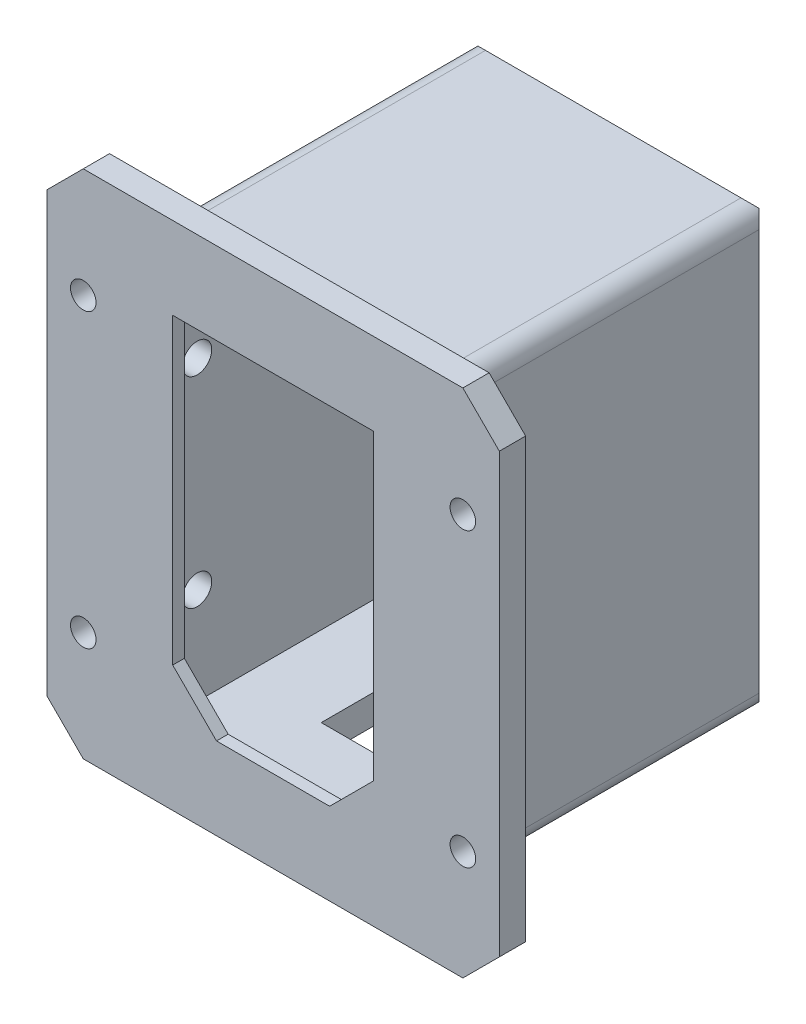
from build123d import *

# Parameters (mm, degrees)
SKETCH1_W           = 62
SKETCH1_H           = 70
SKETCH1_W_2         = 27.5
SKETCH1_H_2         = 47.5
BOSS_EXTRUDE1_DEPTH = 1.6
CHAMFER1_SIZE       = 5
CHAMFER2_SIZE       = 6
SKETCH3_W           = 32
SKETCH3_H           = 52
BOSS_EXTRUDE2_DEPTH = 50
BOSS_EXTRUDE3_DEPTH = 5
SKETCH5_W           = 10
SKETCH5_H           = 45
CUT_EXTRUDE1_DEPTH  = 45
CHAMFER3_SIZE       = 11
CHAMFER4_SIZE       = 10
SKETCH7_R           = 2
CUT_EXTRUDE2_DEPTH  = 83.770767787
MOVE_START          = -2
MOVE_FACE1_DEPTH    = 2
SKETCH8_R           = 1.75
CUT_EXTRUDE3_DEPTH  = 74.413622714


# Read off the part's stored shape, not the designer's step: Move Face1
# Some blends are built 0.0001 mm under size
with BuildPart() as part:
    # Sketch1 → Boss-Extrude1 (new body)
    with BuildSketch(Plane.XY):
        Rectangle(SKETCH1_W, SKETCH1_H)
        Rectangle(SKETCH1_W_2, SKETCH1_H_2, mode=Mode.SUBTRACT)
    extrude(amount=BOSS_EXTRUDE1_DEPTH)

    # Chamfer1
    chamfer1_edges = [part.edges().sort_by_distance(p)[0] for p in [
        (-31, 35, 0.8),
        (31, 35, 0.8),
        (31, -35, 0.8),
        (-31, -35, 0.8),
    ]]
    chamfer(chamfer1_edges, length=CHAMFER1_SIZE)

    # Chamfer2
    chamfer2_edges = [part.edges().sort_by_distance(p)[0] for p in [
        (-13.75, -23.75, 0.8),
        (13.75, -23.75, 0.8),
    ]]
    chamfer(chamfer2_edges, length=CHAMFER2_SIZE)

    # Sketch3 → Boss-Extrude2 (add)
    with BuildSketch(Plane(origin=(0, 0, 0), x_dir=(-1, 0, 0), z_dir=(0, 0, -1))):
        with BuildLine():
            Line((-20, 27.5), (-20, -27.5))
            ThreePointArc((-20, -27.5), (-19.267766953, -29.267766953), (-17.5, -30))
            Line((-17.5, -30), (17.5, -30))
            ThreePointArc((17.5, -30), (19.267766953, -29.267766953), (20, -27.5))
            Line((20, -27.5), (20, 27.5))
            ThreePointArc((20, 27.5), (19.267766953, 29.267766953), (17.5, 30))
            Line((17.5, 30), (-17.5, 30))
            ThreePointArc((-17.5, 30), (-19.267766953, 29.267766953), (-20, 27.5))
        make_face()
        Rectangle(SKETCH3_W, SKETCH3_H, mode=Mode.SUBTRACT)
    extrude(amount=BOSS_EXTRUDE2_DEPTH)

    # Sketch4 → Boss-Extrude3 (add)
    with BuildSketch(Plane(origin=(0, 0, -50), x_dir=(-1, 0, 0), z_dir=(0, 0, -1))):
        with BuildLine():
            Line((17.5, 30), (-17.5, 30))
            ThreePointArc((-17.5, 30), (-19.267766953, 29.267766953), (-20, 27.5))
            Line((-20, 27.5), (-20, -27.5))
            ThreePointArc((-20, -27.5), (-19.267766953, -29.267766953), (-17.5, -30))
            Line((-17.5, -30), (17.5, -30))
            ThreePointArc((17.5, -30), (19.267766953, -29.267766953), (20, -27.5))
            Line((20, -27.5), (20, 27.5))
            ThreePointArc((20, 27.5), (19.267766953, 29.267766953), (17.5, 30))
        make_face()
    extrude(amount=BOSS_EXTRUDE3_DEPTH)

    # Sketch5 → Cut-Extrude1 (cut)
    with BuildSketch(Plane(origin=(0, 0, -55), x_dir=(-1, 0, 0), z_dir=(0, 0, -1))):
        with Locations((0, -7.5)):
            Rectangle(SKETCH5_W, SKETCH5_H)
    extrude(amount=-CUT_EXTRUDE1_DEPTH, mode=Mode.SUBTRACT)

    # Chamfer3
    chamfer3_edges = [part.edges().sort_by_distance(p)[0] for p in [
        (-16, 0, -50),
        (0, 26, -50),
        (16, 0, -50),
    ]]
    chamfer(chamfer3_edges, length=CHAMFER3_SIZE - 0.0001)  # a hair under: the kernel refuses the full size

    # Chamfer4
    # the kernel refuses this chamfer: 10 mm, written as the material it takes off along each edge
    with BuildSketch(Plane(origin=(-43.21682988, 30, -55), x_dir=(0, -0.9996219169112968, -0.027495876610586317), z_dir=(1, 0, 0))) as chamfer4_piece_1:
        Polygon((CHAMFER4_SIZE * 0.999621916911, -CHAMFER4_SIZE * 0.0274958766106), (-CHAMFER4_SIZE * 0.0274958766106, -CHAMFER4_SIZE * 0.999621916911), (0, 0), align=None)
    extrude(amount=86.433659759, mode=Mode.SUBTRACT)
    with BuildSketch(Plane(origin=(20, 53.21682988, -55), x_dir=(-0.9996219169112968, 0, -0.027495876610586317), z_dir=(0, -1, 0)), Plane(origin=(-20, -53.21682988, -55), x_dir=(0.9996219169112968, 0, -0.027495876610586317), z_dir=(0, 1, 0))) as chamfer4_piece_2:
        Polygon((CHAMFER4_SIZE * 0.999621916911, -CHAMFER4_SIZE * 0.0274958766106), (-CHAMFER4_SIZE * 0.0274958766106, -CHAMFER4_SIZE * 0.999621916911), (0, 0), align=None)
    extrude(amount=106.433659759, mode=Mode.SUBTRACT)

    # Sketch7 → Cut-Extrude2 (cut, through all)
    with BuildSketch(Plane(origin=(20, 0, 0), x_dir=(0, 0, -1), z_dir=(1, 0, 0))):
        with Locations(Location((4, 14.75, 0), (0, 0, 90))):
            Circle(SKETCH7_R)
        with Locations(Location((4, -12.75, 0), (0, 0, 90))):
            Circle(SKETCH7_R)
    extrude(amount=-CUT_EXTRUDE2_DEPTH, mode=Mode.SUBTRACT)

    # Move Face1 outline → Move Face1 (add)
    with BuildSketch(Plane.XY.offset(MOVE_START)):
        Polygon((-31, 30), (-31, -30), (-26, -35), (26, -35), (31, -30), (31, 30), (26, 35), (-26, 35), align=None)
        with BuildLine():
            ThreePointArc((-20, 27.5), (-19.267766953, 29.267766953), (-17.5, 30))
            Line((-17.5, 30), (17.5, 30))
            ThreePointArc((17.5, 30), (19.267766953, 29.267766953), (20, 27.5))
            Line((20, 27.5), (20, -27.5))
            ThreePointArc((20, -27.5), (19.267766953, -29.267766953), (17.5, -30))
            Line((17.5, -30), (-17.5, -30))
            ThreePointArc((-17.5, -30), (-19.267766953, -29.267766953), (-20, -27.5))
            Line((-20, -27.5), (-20, 27.5))
        make_face(mode=Mode.SUBTRACT)
    extrude(amount=MOVE_FACE1_DEPTH)

    # Sketch8 → Cut-Extrude3 (cut, through all)
    with BuildSketch(Plane.XY.offset(1.6)):
        with Locations((26, 20)):
            Circle(SKETCH8_R)
        with Locations((26, -20)):
            Circle(SKETCH8_R)
        with Locations((-26, -20)):
            Circle(SKETCH8_R)
        with Locations((-26, 20)):
            Circle(SKETCH8_R)
    extrude(amount=-CUT_EXTRUDE3_DEPTH, mode=Mode.SUBTRACT)


solid = part.part
